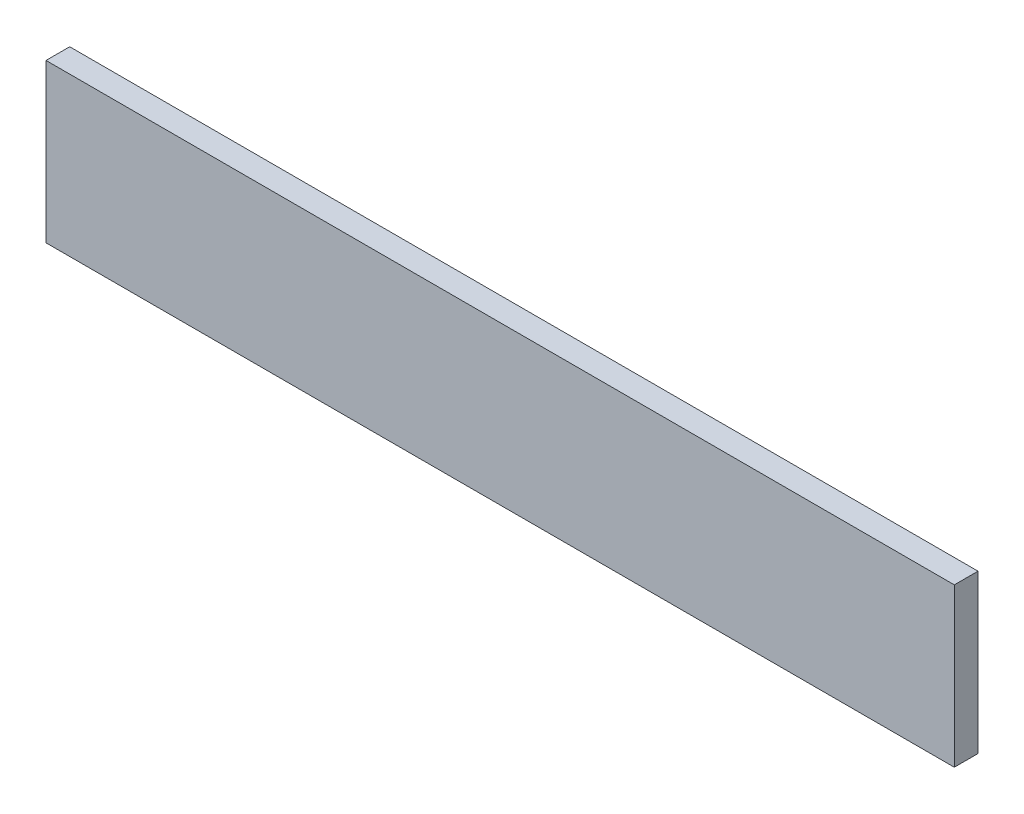
from build123d import *

# Parameters (mm, degrees)
SKETCH1_W           = 730.25
SKETCH1_H           = 127
BOSS_EXTRUDE1_DEPTH = 19.05


with BuildPart() as part:
    # Sketch1 → Boss-Extrude1 (new body)
    with BuildSketch(Plane.XY):
        with Locations((365.125, 63.5)):
            Rectangle(SKETCH1_W, SKETCH1_H)
    extrude(amount=BOSS_EXTRUDE1_DEPTH)


solid = part.part
